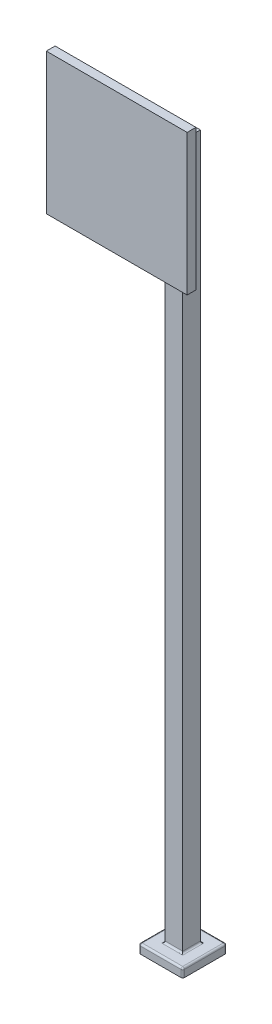
from build123d import *

# Parameters (mm, degrees)
SKETCH1_W           = 100
SKETCH1_H           = 4000
BOSS_EXTRUDE1_DEPTH = 50
SKETCH2_W           = 250
SKETCH2_H           = 250
BOSS_EXTRUDE2_DEPTH = 50
SKETCH3_W           = 400
SKETCH3_H           = 50
BOSS_EXTRUDE3_DEPTH = 25
SKETCH4_W           = 800
SKETCH4_H           = 800
BOSS_EXTRUDE4_DEPTH = 25
FILLET1_R           = 10
FILLET3_R           = 10
FILLET4_R           = 10


with BuildPart() as part:
    # Sketch1 → Boss-Extrude1 (new, symmetric)
    with BuildSketch(Plane.XY):
        with Locations((0, 2000)):
            Rectangle(SKETCH1_W, SKETCH1_H)
    extrude(amount=BOSS_EXTRUDE1_DEPTH, both=True)

    # Sketch2 → Boss-Extrude2 (add)
    with BuildSketch(Plane(origin=(0, 0, 0), x_dir=(1, 0, 0), z_dir=(0, 1, 0))):
        Rectangle(SKETCH2_W, SKETCH2_H)
    extrude(amount=-BOSS_EXTRUDE2_DEPTH)

    # Sketch3 → Boss-Extrude3 (add, symmetric)
    with BuildSketch(Plane(origin=(0, 0, 0), x_dir=(0, 0, -1), z_dir=(1, 0, 0))):
        with Locations((-150, 3975)):
            Rectangle(SKETCH3_W, SKETCH3_H)
    extrude(amount=BOSS_EXTRUDE3_DEPTH, both=True)

    # Sketch4 → Boss-Extrude4 (add, symmetric)
    with BuildSketch(Plane.XY.offset(350)):
        with Locations((0, 3975)):
            Rectangle(SKETCH4_W, SKETCH4_H)
    extrude(amount=BOSS_EXTRUDE4_DEPTH, both=True)

    # Fillet1
    fillet1_edges = [part.edges().sort_by_distance(p)[0] for p in [
        (0, 0, -125),
        (-125, 0, 0),
        (0, 0, 125),
        (125, -25, -125),
        (-125, -25, -125),
        (-125, -25, 125),
        (0, 0, -50),
        (0, 0, 50),
        (50, 0, 0),
        (-50, 0, 0),
        (125, 0, 0),
        (125, -25, 125),
    ]]
    fillet(fillet1_edges, radius=FILLET1_R)

    # Fillet3
    fillet3_edges = [part.edges().sort_by_distance(p)[0] for p in [
        (-25, 3975, 50),
        (-25, 3975, 325),
        (25, 3975, 325),
        (25, 3975, 50),
    ]]
    fillet(fillet3_edges, radius=FILLET3_R)

    # Fillet4
    fillet4_edges = [part.edges().sort_by_distance(p)[0] for p in [
        (0, 3950, 325),
        (0, 4000, 325),
    ]]
    fillet(fillet4_edges, radius=FILLET4_R)


solid = part.part
